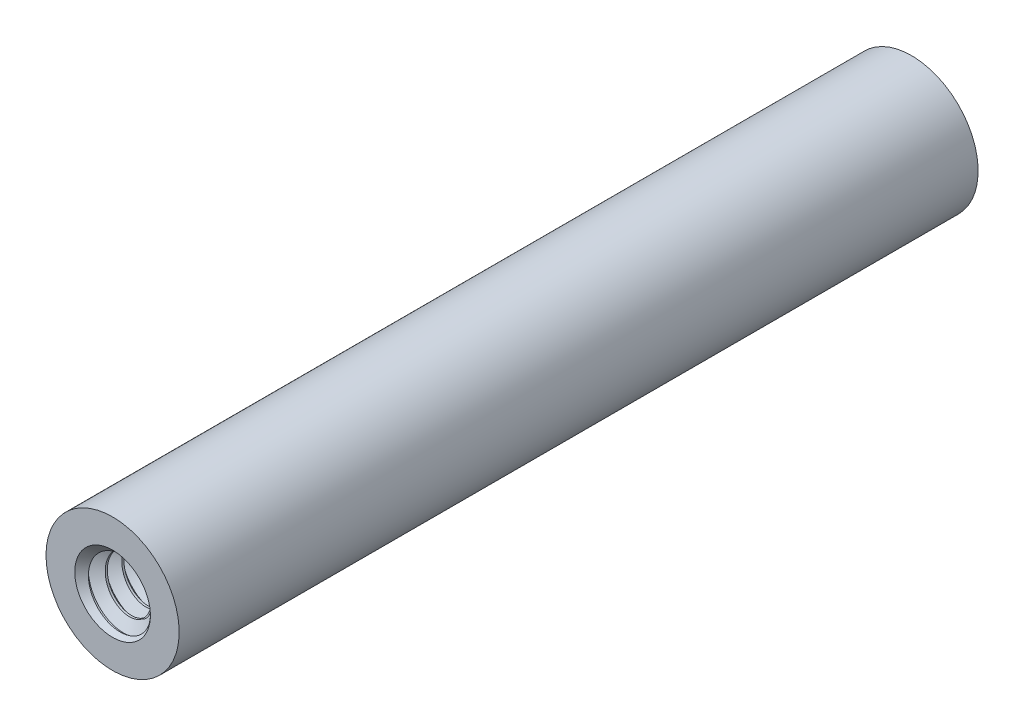
from build123d import *

# Parameters (mm, degrees)
EXTRUDE1_DEPTH      = 19.05
EXTRUDE1_DEPTH_BACK = 19.05
SKETCH1_R           = 3.175
SKETCH1_R_2         = 1.7526
SWEEP1_PITCH        = 0.79375
SKETCH6_R           = 3.175
EXTRUDE2_DEPTH      = 40.152247973
SKETCH9_W           = 19.05
SKETCH9_H           = 1.8034


with BuildPart() as part:
    # Sketch1 → Extrude1 (new, two sides: drawn at the far end of the back side and taken through both)
    with BuildSketch(Plane.XY.offset(-EXTRUDE1_DEPTH_BACK)):
        with Locations(Location((0, 0, 0), (0, 0, 180))):
            Circle(SKETCH1_R)
        with Locations(Location((0, 0, 0), (0, 0, 180))):
            Circle(SKETCH1_R_2, mode=Mode.SUBTRACT)
    extrude(amount=EXTRUDE1_DEPTH + EXTRUDE1_DEPTH_BACK)

    # Sweep1: the profile of Sketch12 profile screwed along a right-hand helix of 49 turns, 8 arcs to a turn; built about Z, then put on its axis
    sweep1_z = Axis((0, 0, 0), (0, 0, 1))
    sweep1_corners = [(1.7529, 0, -0.694704455), (1.7529, 0, 0.000173205), (1.237044252, 0, -0.29765625), (1.237044252, 0, -0.396875)]
    with BuildLine(mode=Mode.PRIVATE) as sweep1_profile:
        Line(sweep1_corners[0], sweep1_corners[1])
        Line(sweep1_corners[1], sweep1_corners[2])
        Line(sweep1_corners[2], sweep1_corners[3])
        Line(sweep1_corners[3], sweep1_corners[0])
    sweep1_cap = Face(sweep1_profile.wire())
    sweep1_turn_angles = [0, 22.5, 45, 67.5, 90, 112.5, 135, 157.5, 180, 202.5, 225, 247.5, 270, 292.5, 315, 337.5, 360, 382.5, 405, 427.5, 450, 472.5, 495, 517.5, 540, 562.5, 585, 607.5, 630, 652.5, 675, 697.5, 720]
    sweep1_turn_weights = [1, 0.9238795325112867, 1, 0.9238795325112867, 1, 0.9238795325112867, 1, 0.9238795325112867, 1, 0.9238795325112867, 1, 0.9238795325112867, 1, 0.9238795325112867, 1, 0.9238795325112867, 1, 0.9238795325112867, 1, 0.9238795325112867, 1, 0.9238795325112867, 1, 0.9238795325112867, 1, 0.9238795325112867, 1, 0.9238795325112867, 1, 0.9238795325112867, 1, 0.9238795325112867, 1]
    sweep1_turn_rails = [Edge.make_bspline([Vector(p[0], p[1], 0).rotate(sweep1_z, sweep1_turn_angles[k]) / sweep1_turn_weights[k] + Vector(0, 0, p[2] + SWEEP1_PITCH * sweep1_turn_angles[k] / 360) for k in range(33)], [0, 0, 0, 1, 1, 2, 2, 3, 3, 4, 4, 5, 5, 6, 6, 7, 7, 8, 8, 9, 9, 10, 10, 11, 11, 12, 12, 13, 13, 14, 14, 15, 15, 16, 16, 16], 2, sweep1_turn_weights) for p in sweep1_corners]
    sweep1_turn_sides = [Face.make_surface_from_curves(sweep1_turn_rails[p[0]], sweep1_turn_rails[p[1]]) for p in [(0, 1), (1, 2), (2, 3), (3, 0)]]
    sweep1_last_angles = [17280, 17302.5, 17325, 17347.5, 17370, 17392.5, 17415, 17437.5, 17460, 17482.5, 17505, 17527.5, 17550, 17572.5, 17595, 17617.5, 17640]
    sweep1_last_weights = [1, 0.9238795325112867, 1, 0.9238795325112867, 1, 0.9238795325112867, 1, 0.9238795325112867, 1, 0.9238795325112867, 1, 0.9238795325112867, 1, 0.9238795325112867, 1, 0.9238795325108979, 1]
    sweep1_last_rails = [Edge.make_bspline([Vector(p[0], p[1], 0).rotate(sweep1_z, sweep1_last_angles[k]) / sweep1_last_weights[k] + Vector(0, 0, p[2] + SWEEP1_PITCH * sweep1_last_angles[k] / 360) for k in range(17)], [0, 0, 0, 1, 1, 2, 2, 3, 3, 4, 4, 5, 5, 6, 6, 7, 7, 8, 8, 8], 2, sweep1_last_weights) for p in sweep1_corners]
    sweep1_last_sides = [Face.make_surface_from_curves(sweep1_last_rails[p[0]], sweep1_last_rails[p[1]]) for p in [(0, 1), (1, 2), (2, 3), (3, 0)]]
    sweep1 = Plane(origin=(0, 0, -19.05), x_dir=(0, 1, 0), z_dir=(0, 0, 1)) * Solid(Shell([*[p.moved(Location((0, 0, 2 * SWEEP1_PITCH * i))) for i in range(24) for p in sweep1_turn_sides], *sweep1_last_sides, sweep1_cap, sweep1_cap.rotate(sweep1_z, 17640).moved(Location((0, 0, SWEEP1_PITCH * 17640 / 360)))]))
    add(sweep1)

    # Sketch6 → Extrude2 (cut, through all)
    with BuildSketch(Plane(origin=(0, 0, -19.05), x_dir=(-1, 0, 0), z_dir=(0, 0, -1))):
        Circle(SKETCH6_R)
    extrude2 = extrude(amount=EXTRUDE2_DEPTH, mode=Mode.SUBTRACT)

    # Extrude3 cone 1 section (through the dimple's axis) → Extrude3 (revolve, cut)
    with BuildSketch(Plane(origin=(0, 0, -19.05), x_dir=(0, 1, 0), z_dir=(1, 0, 0))):
        Polygon((0, 0), (1.8034, 0), (0, 1.933909732), align=None)
    extrude3 = revolve(axis=Axis((0, 0, -19.05), (0, 0, 1)), mode=Mode.SUBTRACT)

    # Mirror1: Extrude2, Extrude3 across plane
    add(extrude2.mirror(Plane.XY), mode=Mode.SUBTRACT)
    add(extrude3.mirror(Plane.XY), mode=Mode.SUBTRACT)

    # Sketch9 → Revolve 2 (revolve)
    with BuildSketch(Plane(origin=(0, 0, 0), x_dir=(0, 0, -1), z_dir=(1, 0, 0)), mode=Mode.PRIVATE) as revolve_2_sk:
        with Locations((0, 0.9017)):
            Rectangle(SKETCH9_W, SKETCH9_H)
    revolve(revolve_2_sk.sketch.rotate(Axis((0, 0, 19.05), (0, 0, -1)), 270), axis=Axis((0, 0, 19.05), (0, 0, -1)))


solid = part.part
